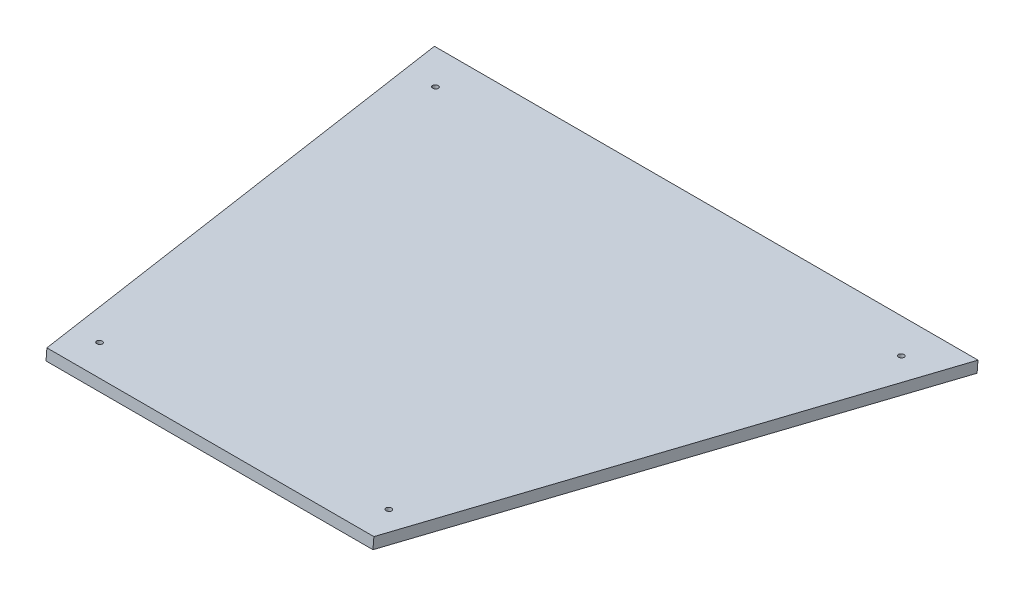
from build123d import *

# Parameters (mm, degrees)
BOSS_EXTRUDE1_DEPTH = 12.7
SKETCH2_R           = 3.175000009
CUT_EXTRUDE1_DEPTH  = 2375.892579799


with BuildPart() as part:
    # Sketch1 → Boss-Extrude1 (new body)
    with BuildSketch(Plane(origin=(-0.000847367, -10571.560949802, 872.084725269), x_dir=(-0.9999999999999969, 7.96141416871426e-08, -6.567661367452001e-09), z_dir=(-7.988457756299225e-08, -0.9966146823530269, 0.08221420143970955))):
        Polygon((927.932358982, -1893.288402131), (1306.839320101, -1893.288402131), (1432.35206283, -1316.739819062), (802.419616254, -1316.739819062), align=None)
    extrude(amount=BOSS_EXTRUDE1_DEPTH)

    # Sketch2 → Cut-Extrude1 (cut, through all)
    with BuildSketch(Plane(origin=(-0.000847373, -10571.560949802, 872.084725269), x_dir=(0.9999999999999968, -7.961414422751635e-08, 6.5676468617910225e-09), z_dir=(7.988457890219469e-08, 0.9966146823530273, -0.08221420143970454))):
        with Locations((-1284.956595845, -1854.019614904)):
            Circle(SKETCH2_R)
        with Locations((-949.797461589, -1853.938669103)):
            Circle(SKETCH2_R)
        with Locations((-1387.301054823, -1360.701208826)):
            Circle(SKETCH2_R)
        with Locations((-847.470624247, -1360.701208826)):
            Circle(SKETCH2_R)
    extrude(amount=-CUT_EXTRUDE1_DEPTH, mode=Mode.SUBTRACT)


solid = part.part
